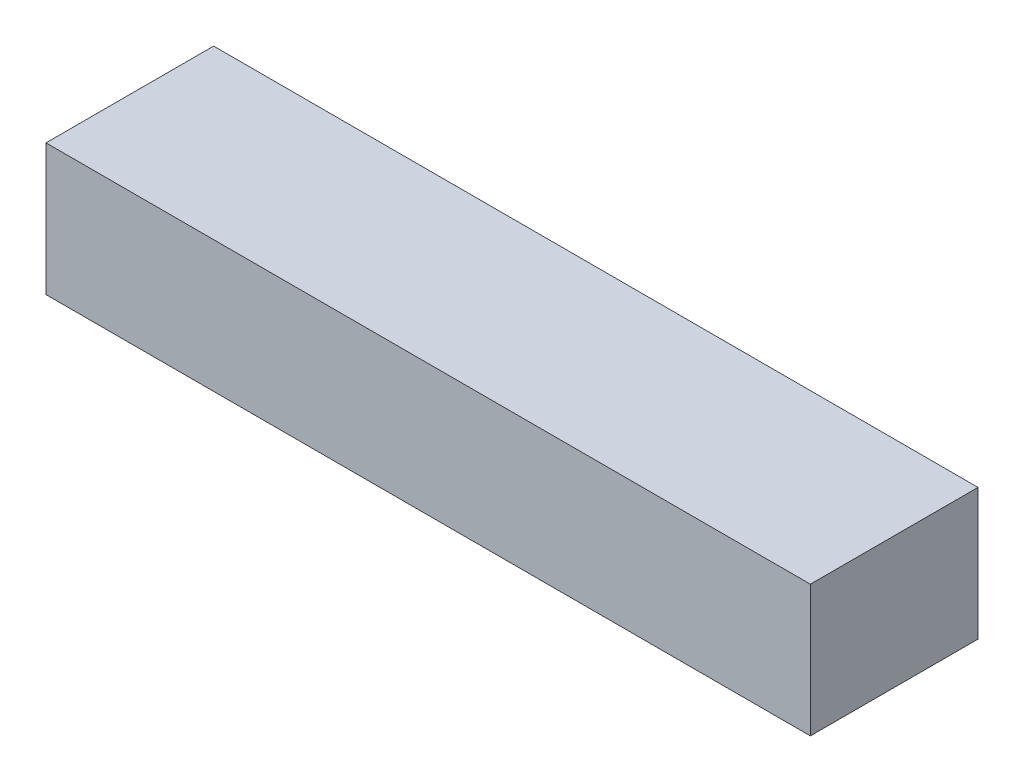
from build123d import *

# Parameters (mm, degrees)
SKETCH1_W           = 1140
SKETCH1_H           = 250
BOSS_EXTRUDE1_DEPTH = 196


with BuildPart() as part:
    # Sketch1 → Boss-Extrude1 (new body)
    with BuildSketch(Plane(origin=(0, 0, 0), x_dir=(1, 0, 0), z_dir=(0, 1, 0))):
        Rectangle(SKETCH1_W, SKETCH1_H)
    extrude(amount=BOSS_EXTRUDE1_DEPTH)


solid = part.part
